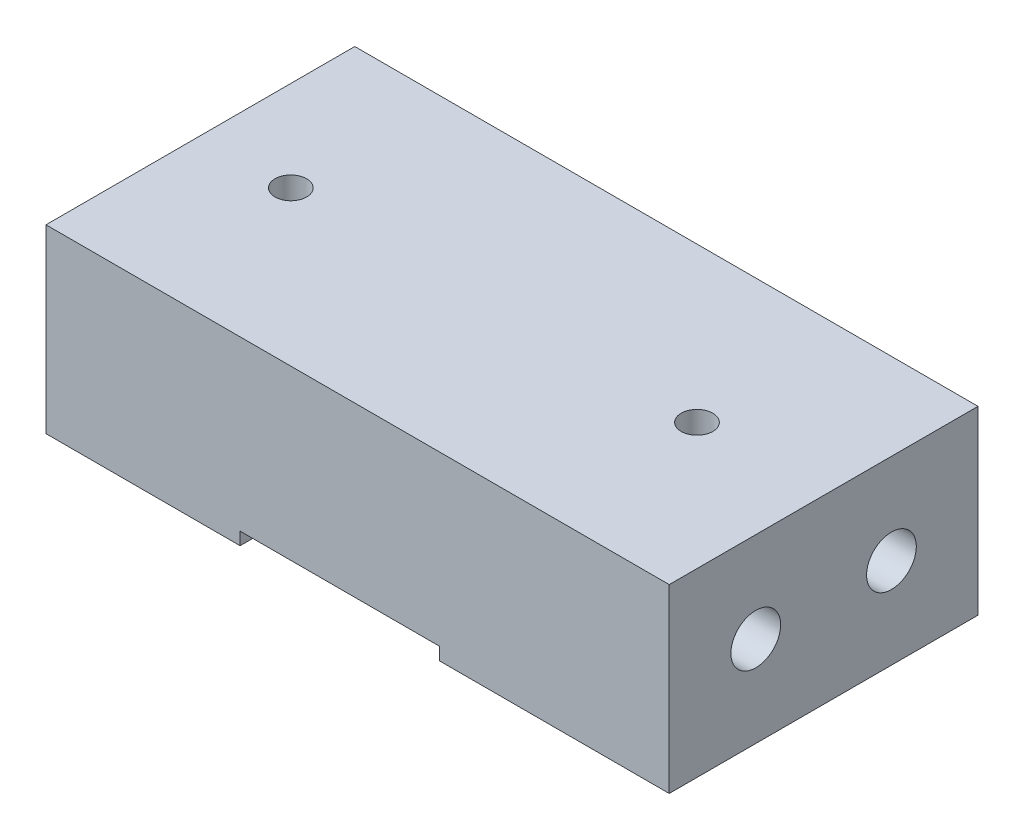
from build123d import *

# Parameters (mm, degrees)
SKETCH1_W           = 68.896006058
SKETCH1_H           = 34.135361424
BOSS_EXTRUDE1_DEPTH = 20
CUT_EXTRUDE1_REACH  = 54.458
SKETCH2_W           = 22.032289941
SKETCH2_H           = 1.4
SKETCH7_R           = 2.75
CUT_EXTRUDE4_DEPTH  = 30
CUT_EXTRUDE5_REACH  = 45.336
SKETCH8_R           = 1.75


with BuildPart() as part:
    # Sketch1 → Boss-Extrude1 (new body)
    with BuildSketch(Plane(origin=(0, 0, 0), x_dir=(1, 0, 0), z_dir=(0, 1, 0))):
        Rectangle(SKETCH1_W, SKETCH1_H)
    extrude(amount=BOSS_EXTRUDE1_DEPTH)

    # Sketch2 → Cut-Extrude1 (cut, up to next)
    with BuildSketch(Plane(origin=(0, 0, -17.067680712), x_dir=(-1, 0, 0), z_dir=(0, 0, -1)), mode=Mode.PRIVATE) as cut_extrude1_sk1:
        with Locations((1.973306179, 0.7)):
            Rectangle(SKETCH2_W, SKETCH2_H)
    cut_extrude1_tool1 = extrude(cut_extrude1_sk1.sketch, amount=-CUT_EXTRUDE1_REACH, mode=Mode.PRIVATE) & part.part
    add(cut_extrude1_tool1.solids().sort_by_distance((-1.973306, 0.7, -17.067681))[0], mode=Mode.SUBTRACT)

    # Sketch7 → Cut-Extrude4 (cut)
    with BuildSketch(Plane(origin=(34.448003029, 0, 0), x_dir=(0, 0, -1), z_dir=(1, 0, 0))):
        with Locations((-7.5, 10)):
            Circle(SKETCH7_R)
        with Locations((7.5, 10)):
            Circle(SKETCH7_R)
    extrude(amount=-CUT_EXTRUDE4_DEPTH, mode=Mode.SUBTRACT)

    # Sketch8 → Cut-Extrude5 (cut, up to next)
    with BuildSketch(Plane.XZ, mode=Mode.PRIVATE) as cut_extrude5_sk1:
        with Locations((-24.448003029, 0)):
            Circle(SKETCH8_R)
    cut_extrude5_tool1 = extrude(cut_extrude5_sk1.sketch, amount=-CUT_EXTRUDE5_REACH, mode=Mode.PRIVATE) & part.part
    # Sketch8 → Cut-Extrude5 (cut, up to next)
    with BuildSketch(Plane.XZ, mode=Mode.PRIVATE) as cut_extrude5_sk2:
        with Locations((20.448003029, 0)):
            Circle(SKETCH8_R)
    cut_extrude5_tool2 = extrude(cut_extrude5_sk2.sketch, amount=-CUT_EXTRUDE5_REACH, mode=Mode.PRIVATE) & part.part
    add(cut_extrude5_tool1.solids().sort_by_distance((-24.448003, 0, 0))[0], mode=Mode.SUBTRACT)
    add(cut_extrude5_tool2.solids().sort_by_distance((20.448003, 0, 0))[0], mode=Mode.SUBTRACT)


solid = part.part
